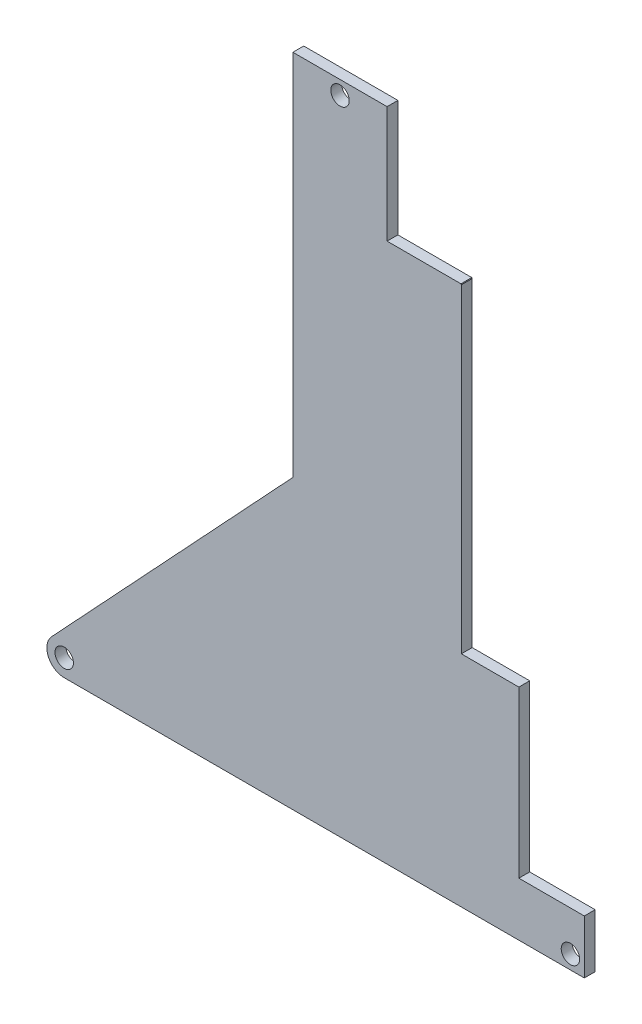
from build123d import *

# Parameters (mm, degrees)
BOSS_EXTRUDE1_DEPTH   = 1.5875
F_2_CLEARANCE_HOLE1_D = 2.7051
CUT_EXTRUDE1_DEPTH    = 92.527932701


with BuildPart() as part:
    # Sketch1 → Boss-Extrude1 (new body)
    with BuildSketch(Plane.XY):
        with BuildLine():
            Line((-52.648603939, -67.272400153), (-30.578425, -43.620868829))
            Line((-30.578425, -43.620868829), (-18.837275, -31.03845263))
            Line((-18.837275, -31.03845263), (-18.837275, 15.096748243))
            Line((-18.837275, 15.096748243), (-18.837275, 22.917825485))
            Line((-18.837275, 22.917825485), (-5.036497092, 22.917825485))
            ThreePointArc((-5.036497092, 22.917825485), (16.456769026, -18.908795935), (23.866475, -65.347174515))
            Line((23.866475, -65.347174515), (23.866475, -73.221174515))
            Line((23.866475, -73.221174515), (-30.578425, -73.221174515))
            Line((-30.578425, -73.221174515), (-52.355372399, -73.221174515))
            ThreePointArc((-52.355372399, -73.221174515), (-54.684874047, -71.693608254), (-54.212432291, -68.948278512))
            Line((-54.212432291, -68.948278512), (-52.648603939, -67.272400153))
        make_face()
    extrude(amount=BOSS_EXTRUDE1_DEPTH)

    # #2 Clearance Hole1 (through all)
    with Locations(Plane(origin=(0, 0, 0), x_dir=(-1, 0, 0), z_dir=(0, 0, -1))):
        with Locations((-21.834475, -71.189174515), (52.355372399, -70.681174515), (11.936886046, 20.885825485)):
            Hole(F_2_CLEARANCE_HOLE1_D / 2)

    # Sketch4 → Cut-Extrude1 (cut, through all)
    with BuildSketch(Plane(origin=(0, 0, 0), x_dir=(-1, 0, 0), z_dir=(0, 0, -1))):
        with BuildLine():
            Line((-23.866475, -65.347174515), (-14.277975, -65.347174515))
            Line((-14.277975, -65.347174515), (-14.277975, -41.090174515))
            Line((-14.277975, -41.090174515), (-5.845175, -41.090174515))
            Line((-5.845175, -41.090174515), (-5.845175, 5.742133621))
            ThreePointArc((-5.845175, 5.742133621), (-19.29100448, -28.678192443), (-23.866475, -65.347174515))
        make_face()
        with BuildLine():
            ThreePointArc((5.036497092, 22.917825485), (-0.665836205, 14.565033613), (-5.789292349, 5.845175))
            Line((-5.789292349, 5.845175), (5.036497092, 5.845175))
            Line((5.036497092, 5.845175), (5.036497092, 22.917825485))
        make_face()
    extrude(amount=-CUT_EXTRUDE1_DEPTH, mode=Mode.SUBTRACT)


solid = part.part
